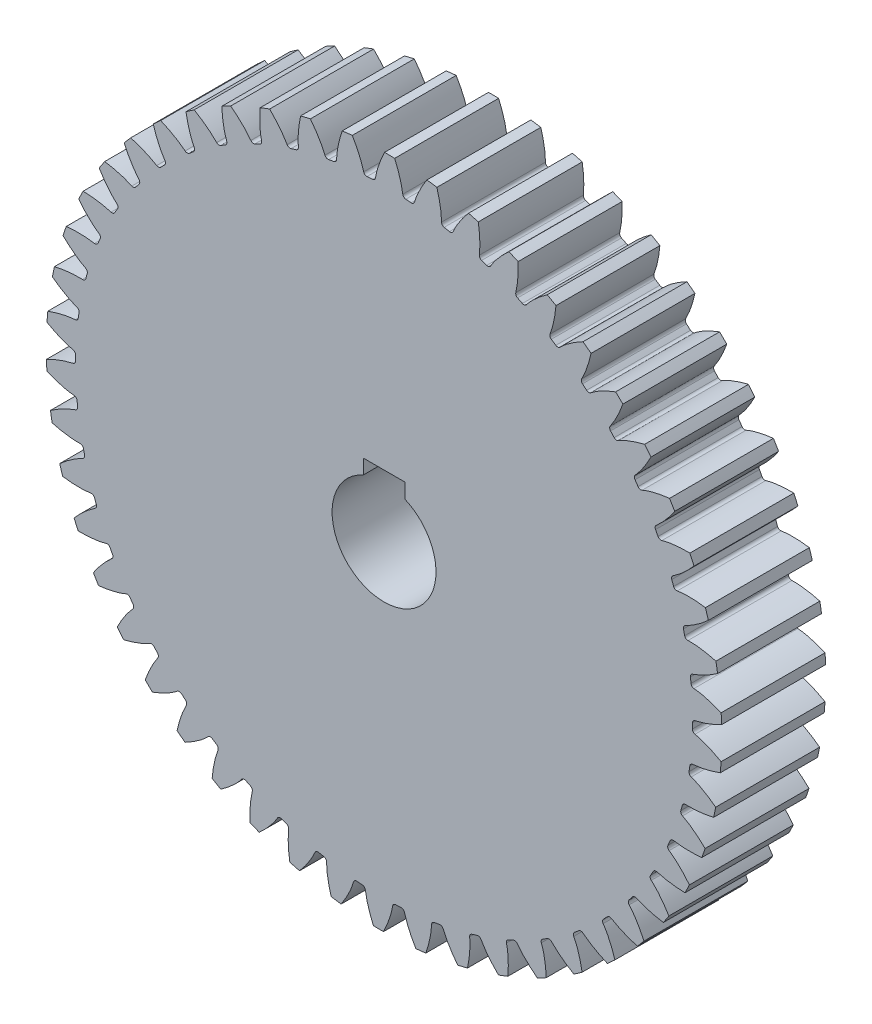
from build123d import *

# Parameters (mm, degrees)
SKETCH_1_R                       = 65
EXTRUDE_1_DEPTH                  = 20
CUT_EXTRUDE_1_DEPTH              = 95.074438611
FILLET_1_R                       = 0.625
PATTERN_CIRCULAR_1_COUNT         = 50
FILLET_1_OF_PATTERN_CIRCULAR_1_R = 0.625
CUT_EXTRUDE_2_DEPTH              = 95.052234106


with BuildPart() as part:
    # 草图1 → 凸台-拉伸1 (new body)
    with BuildSketch(Plane.XY):
        Circle(SKETCH_1_R)
    extrude(amount=EXTRUDE_1_DEPTH)

    # 草图2 → 切除-拉伸1 (cut, through all)
    with BuildSketch(Plane(origin=(0, 0, 0), x_dir=(-1, 0, 0), z_dir=(0, 0, -1))):
        with BuildLine():
            ThreePointArc((-59.37496549, 0.064015751), (-59.366906412, -0.980330596), (-59.340479745, -2.024373638))
            add(Edge.make_bspline(
                [(-59.340479745, -2.024373638), (-59.358585741, -2.027217063), (-59.489123343, -2.048148653), (-59.732256343, -2.092794267), (-60.141473924, -2.182476218), (-60.69491591, -2.331293646), (-61.296888942, -2.522432884), (-61.943835243, -2.759591462), (-62.581603801, -3.022102664), (-63.209576089, -3.307253805), (-63.82775888, -3.612954349), (-64.317275295, -3.874161815), (-64.650689539, -4.061387893), (-64.832592423, -4.166289587), (-64.865126249, -4.185139986)],
                knots=[0.025622171, 0.025622171, 0.025622171, 0.025622171, 0.025622171, 0.02853182, 0.046610139, 0.064854849, 0.092110525, 0.119476175, 0.146842495, 0.174208853, 0.201574955, 0.228941013, 0.256307345, 0.26227653, 0.26227653, 0.26227653, 0.26227653, 0.26227653], degree=4))
            ThreePointArc((-64.865126249, -4.185139986), (-64.991139651, -1.073204021), (-64.967942244, 2.041195874))
            add(Edge.make_bspline(
                [(-59.37496549, 0.064015751), (-59.442683843, 0.07412561), (-59.654454036, 0.108010749), (-60.009955515, 0.17591577), (-60.576981101, 0.307318024), (-61.284155703, 0.506587136), (-62.052890913, 0.760850681), (-62.878573477, 1.074801624), (-63.692097746, 1.421104734), (-64.313524527, 1.712314605), (-64.730041571, 1.919390932), (-64.947356938, 2.030629903), (-64.967942244, 2.041195874)],
                knots=[0.020052803, 0.020052803, 0.020052803, 0.020052803, 0.020052803, 0.02853182, 0.046610139, 0.064854849, 0.092110525, 0.119476175, 0.146842495, 0.174208853, 0.201574955, 0.204440268, 0.204440268, 0.204440268, 0.204440268, 0.204440268], degree=4))
        make_face()
    cut_extrude_1 = extrude(amount=-CUT_EXTRUDE_1_DEPTH, mode=Mode.SUBTRACT)

    # 圆角1
    fillet_1_edges = [part.edges().sort_by_distance(p)[0] for p in [
        (59.340479745, -2.024373638, 10),
        (59.37496549, 0.064015751, 10),
    ]]
    fillet(fillet_1_edges, radius=FILLET_1_R)

    # 阵列(圆周)1: 切除-拉伸1 ×50 about axis
    pattern_circular_1_axis = Axis((0, 0, 20), (0, 0, -1))
    for i in range(1, PATTERN_CIRCULAR_1_COUNT):
        add(cut_extrude_1.rotate(pattern_circular_1_axis, i * 360 / PATTERN_CIRCULAR_1_COUNT), mode=Mode.SUBTRACT)

    # 圆角1 of 阵列(圆周)1
    fillet_1_of_pattern_circular_1_edges = [part.edges().sort_by_distance(p)[0] for p in [
        (58.618841044, -9.445745055, 10),
        (58.914799454, -7.37814545, 10),
        (56.972748203, -16.71815143, 10),
        (57.525511837, -14.70394889, 10),
        (54.428161088, -23.72690257, 10),
        (55.229012533, -21.797862272, 10),
        (51.02520936, -30.361466282, 10),
        (52.06151871, -28.548010344, 10),
        (46.817559598, -36.517211534, 10),
        (48.072983637, -34.84793924, 10),
        (41.871568955, -42.097058546, 10),
        (43.326308894, -40.598295317, 10),
        (36.265238656, -47.013009797, 10),
        (37.896352378, -45.708392024, 10),
        (30.08698388, -51.1875378, 10),
        (31.868747747, -50.097640084, 10),
        (23.434239395, -54.554807753, 10),
        (25.338553927, -53.696818434, 10),
        (16.411922955, -57.061715799, 10),
        (18.408755974, -56.449165879, 10),
        (9.130780687, -58.668726499, 10),
        (11.188640943, -58.311276258, 10),
        (1.705640553, -59.350496336, 10),
        (3.792074361, -59.253782977, 10),
        (-5.746398552, -59.096273391, 10),
        (-3.664295499, -59.261822141, 10),
        (-13.107813518, -57.910066912, 10),
        (-11.062877231, -58.335266969, 10),
        (-20.262510436, -55.810584084, 10),
        (-18.28699078, -56.488729789, 10),
        (-27.097655459, -52.830935006, 10),
        (-25.22270756, -53.751331596, 10),
        (-33.505454269, -49.018110523, 10),
        (-31.760647174, -50.166242794, 10),
        (-39.384852049, -44.432241155, 10),
        (-37.79770241, -45.790002375, 10),
        (-44.643127186, -39.145648801, 10),
        (-43.2386653, -40.691626265, 10),
        (-49.197353538, -33.241706182, 10),
        (-47.997728608, -34.951518901, 10),
        (-52.975708236, -26.813521998, 10),
        (-51.999839063, -28.660205205, 10),
        (-55.918604368, -19.962472555, 10),
        (-55.181880994, -21.916902952, 10),
        (-57.979630706, -12.796602994, 10),
        (-57.493671697, -14.827958047, 10),
        (-59.126283632, -5.42892336, 10),
        (-58.898752852, -7.505167386, 10),
        (-59.340479745, 2.024373638, 10),
        (-59.37496549, -0.064015751, 10),
        (-58.618841044, 9.445745055, 10),
        (-58.914799454, 7.37814545, 10),
        (-56.972748203, 16.71815143, 10),
        (-57.525511837, 14.70394889, 10),
        (-54.428161088, 23.72690257, 10),
        (-55.229012533, 21.797862272, 10),
        (-51.02520936, 30.361466282, 10),
        (-52.06151871, 28.548010344, 10),
        (-46.817559598, 36.517211534, 10),
        (-48.072983637, 34.84793924, 10),
        (-41.871568955, 42.097058546, 10),
        (-43.326308894, 40.598295317, 10),
        (-36.265238656, 47.013009797, 10),
        (-37.896352378, 45.708392024, 10),
        (-30.08698388, 51.1875378, 10),
        (-31.868747747, 50.097640084, 10),
        (-23.434239395, 54.554807753, 10),
        (-25.338553927, 53.696818434, 10),
        (-16.411922955, 57.061715799, 10),
        (-18.408755974, 56.449165879, 10),
        (-9.130780687, 58.668726499, 10),
        (-11.188640943, 58.311276258, 10),
        (-1.705640553, 59.350496336, 10),
        (-3.792074361, 59.253782977, 10),
        (5.746398552, 59.096273391, 10),
        (3.664295499, 59.261822141, 10),
        (13.107813518, 57.910066912, 10),
        (11.062877231, 58.335266969, 10),
        (20.262510436, 55.810584084, 10),
        (18.28699078, 56.488729789, 10),
        (27.097655459, 52.830935006, 10),
        (25.22270756, 53.751331596, 10),
        (33.505454269, 49.018110523, 10),
        (31.760647174, 50.166242794, 10),
        (39.384852049, 44.432241155, 10),
        (37.79770241, 45.790002375, 10),
        (44.643127186, 39.145648801, 10),
        (43.2386653, 40.691626265, 10),
        (49.197353538, 33.241706182, 10),
        (47.997728608, 34.951518901, 10),
        (52.975708236, 26.813521998, 10),
        (51.999839063, 28.660205205, 10),
        (55.918604368, 19.962472555, 10),
        (55.181880994, 21.916902952, 10),
        (57.979630706, 12.796602994, 10),
        (57.493671697, 14.827958047, 10),
        (59.126283632, 5.42892336, 10),
        (58.898752852, 7.505167386, 10),
    ]]
    fillet(fillet_1_of_pattern_circular_1_edges, radius=FILLET_1_OF_PATTERN_CIRCULAR_1_R)

    # 草图3 → 切除-拉伸2 (cut, through all)
    with BuildSketch(Plane(origin=(0, 0, 0), x_dir=(-1, 0, 0), z_dir=(0, 0, -1))):
        with BuildLine():
            Line((-4, 9.16515139), (-4, 12))
            Line((-4, 12), (4, 12))
            Line((4, 12), (4, 9.16515139))
            ThreePointArc((4, 9.16515139), (0, -10), (-4, 9.16515139))
        make_face()
    extrude(amount=-CUT_EXTRUDE_2_DEPTH, mode=Mode.SUBTRACT)


solid = part.part
